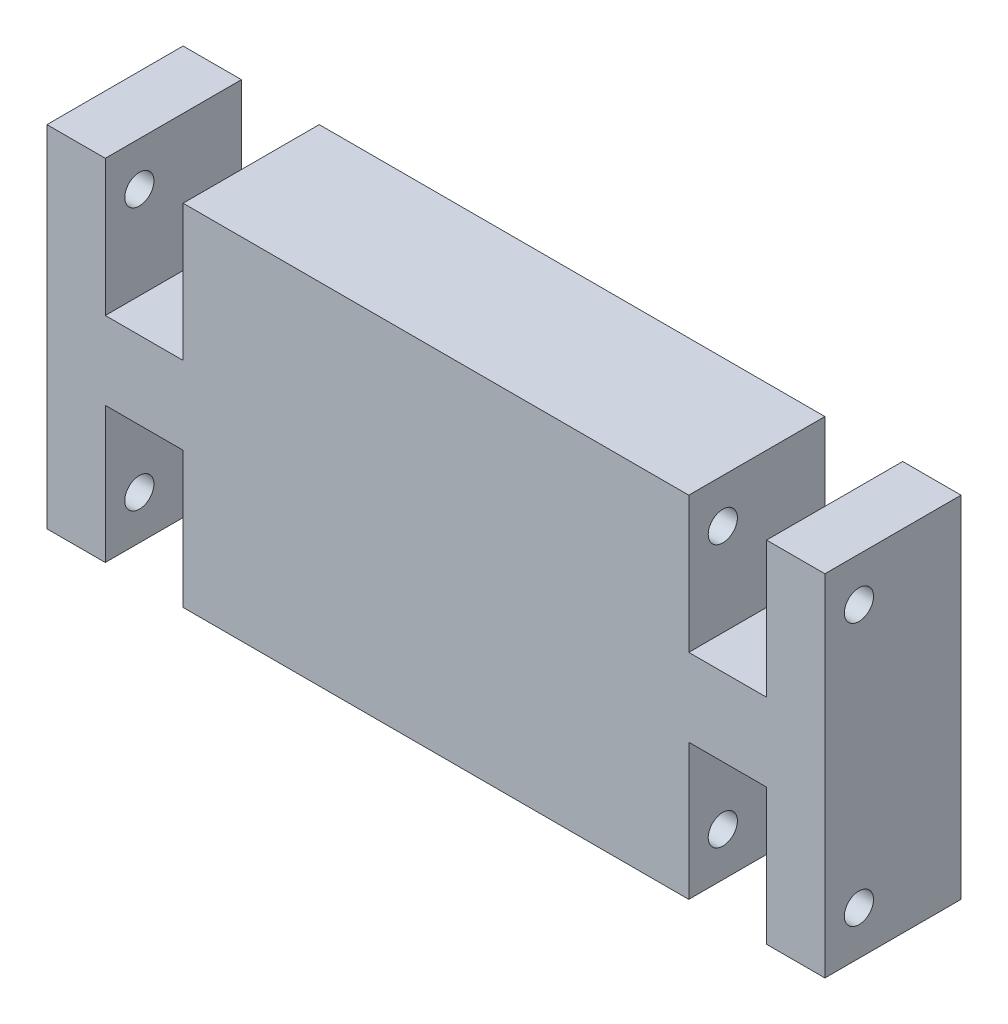
from build123d import *

# Parameters (mm, degrees)
CROQUIS2_W              = 400
CROQUIS2_H              = 180
SALIENTE_EXTRUIR3_DEPTH = 70
CROQUIS3_W              = 40
CROQUIS3_H              = 70
CORTAR_EXTRUIR1_DEPTH   = 70
CROQUIS4_R              = 7.5
CORTAR_EXTRUIR2_DEPTH   = 400


with BuildPart() as part:
    # Croquis2 → Saliente-Extruir3 (new body)
    with BuildSketch(Plane.XY):
        with Locations((200, 90)):
            Rectangle(CROQUIS2_W, CROQUIS2_H)
    extrude(amount=SALIENTE_EXTRUIR3_DEPTH)

    # Croquis3 → Cortar-Extruir1 (cut)
    with BuildSketch(Plane.XY.offset(70)):
        with Locations((50, 35)):
            Rectangle(CROQUIS3_W, CROQUIS3_H)
        with Locations((350, 35)):
            Rectangle(CROQUIS3_W, CROQUIS3_H)
        with Locations((350, 145)):
            Rectangle(CROQUIS3_W, CROQUIS3_H)
        with Locations((50, 145)):
            Rectangle(CROQUIS3_W, CROQUIS3_H)
    extrude(amount=-CORTAR_EXTRUIR1_DEPTH, mode=Mode.SUBTRACT)

    # Croquis4 → Cortar-Extruir2 (cut)
    with BuildSketch(Plane(origin=(400, 0, 0), x_dir=(0, 0, -1), z_dir=(1, 0, 0))):
        with Locations((-52.5, 157.5)):
            Circle(CROQUIS4_R)
        with Locations((-52.5, 22.5)):
            Circle(CROQUIS4_R)
    extrude(amount=-CORTAR_EXTRUIR2_DEPTH, mode=Mode.SUBTRACT)


solid = part.part
